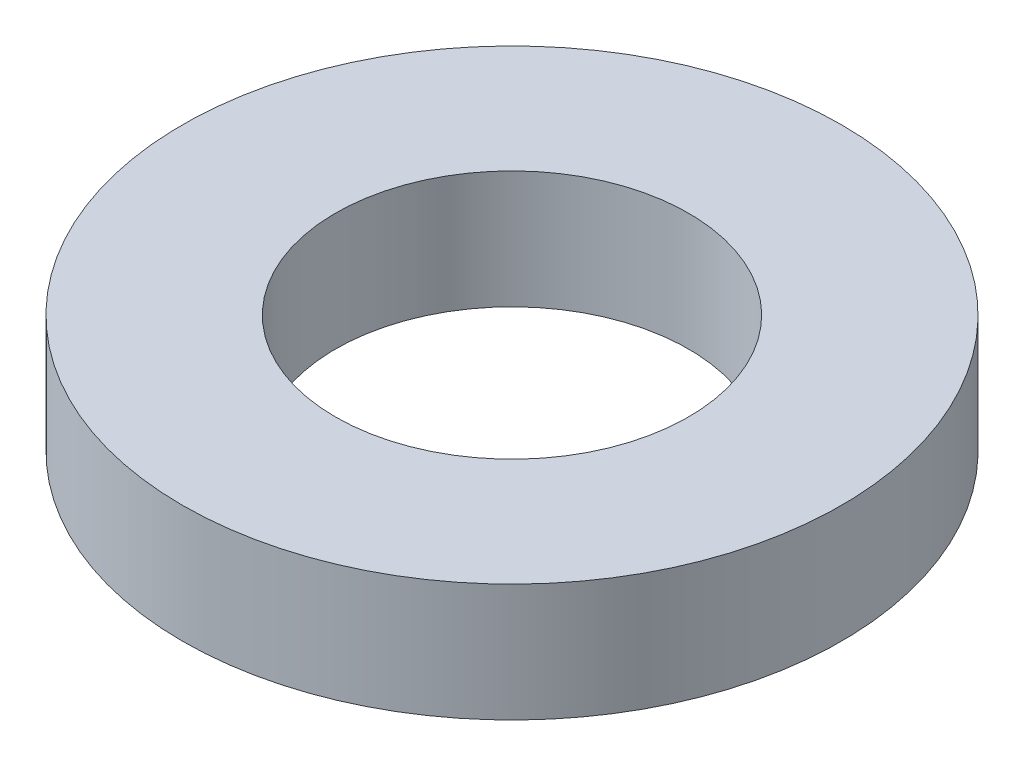
from build123d import *

# Parameters (mm, degrees)
SKETCH1_R           = 2.8
SKETCH1_R_2         = 1.5
BOSS_EXTRUDE1_DEPTH = 1


with BuildPart() as part:
    # Sketch1 → Boss-Extrude1 (new body)
    with BuildSketch(Plane(origin=(0, 0, 0), x_dir=(1, 0, 0), z_dir=(0, 1, 0))):
        Circle(SKETCH1_R)
        Circle(SKETCH1_R_2, mode=Mode.SUBTRACT)
    extrude(amount=BOSS_EXTRUDE1_DEPTH)


solid = part.part
